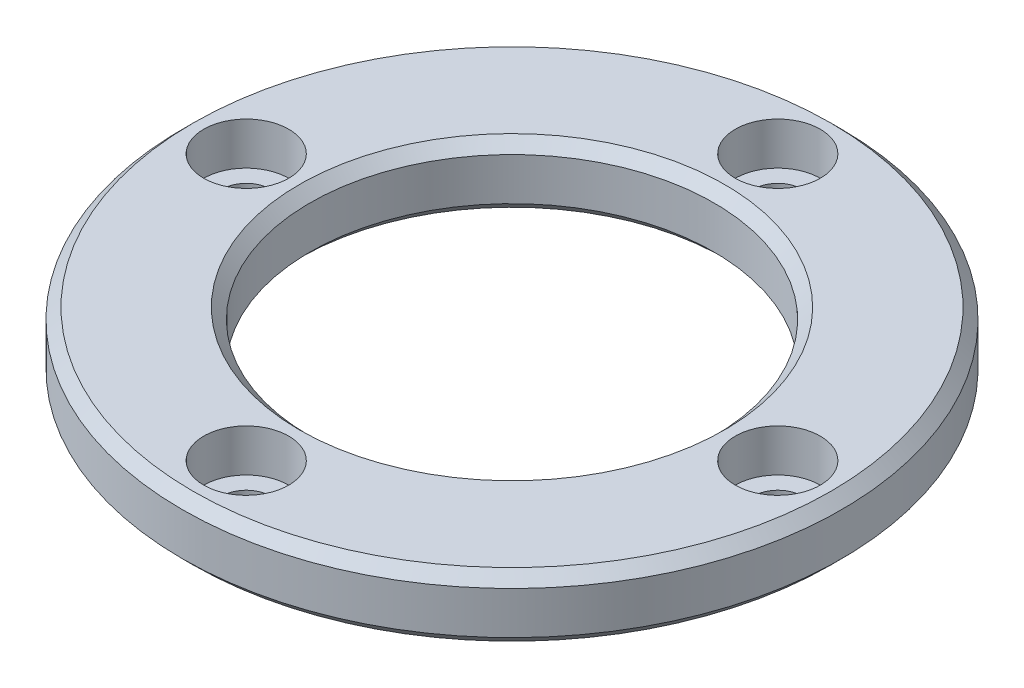
from build123d import *

# Parameters (mm, degrees)
SKETCH1_R                      = 31
SKETCH1_R_2                    = 19
BOSS_EXTRUDE1_DEPTH            = 3
CBORE_FOR_M4_SHCS1_D           = 4.5
CBORE_FOR_M4_SHCS1_CBORE_D     = 8
CBORE_FOR_M4_SHCS1_CBORE_DEPTH = 4
CHAMFER1_SIZE                  = 1
BOSS_EXTRUDE2_START            = 2
SKETCH4_R                      = 3
SKETCH4_R_2                    = 2.25
BOSS_EXTRUDE2_DEPTH            = 2
CHAMFER2_SIZE                  = 0.2
CIRPATTERN1_COUNT              = 4
CHAMFER2_OF_CIRPATTERN1_SIZE   = 0.2


with BuildPart() as part:
    # Sketch1 → Boss-Extrude1 (new, symmetric)
    with BuildSketch(Plane(origin=(0, 0, 0), x_dir=(1, 0, 0), z_dir=(0, 1, 0))):
        Circle(SKETCH1_R)
        Circle(SKETCH1_R_2, mode=Mode.SUBTRACT)
    extrude(amount=BOSS_EXTRUDE1_DEPTH, both=True)

    # CBORE for M4 SHCS1 (through all)
    with Locations(Plane(origin=(0, 3, 0), x_dir=(1, 0, 0), z_dir=(0, 1, 0))):
        with Locations((-25, 0), (0, 25), (25, 0), (0, -25)):
            CounterBoreHole(CBORE_FOR_M4_SHCS1_D / 2, CBORE_FOR_M4_SHCS1_CBORE_D / 2, CBORE_FOR_M4_SHCS1_CBORE_DEPTH)

    # Chamfer1
    chamfer1_edges = [part.edges().sort_by_distance(p)[0] for p in [
        (-31, -3, 0),
        (-31, 3, 0),
        (-19, -3, 0),
        (-19, 3, 0),
    ]]
    chamfer(chamfer1_edges, length=CHAMFER1_SIZE)

    # Sketch4 → Boss-Extrude2 (add)
    with BuildSketch(Plane.XZ.offset(3).offset(BOSS_EXTRUDE2_START)):
        with Locations((-25, 0)):
            Circle(SKETCH4_R)
        with Locations((-25, 0)):
            Circle(SKETCH4_R_2, mode=Mode.SUBTRACT)
    boss_extrude2 = extrude(amount=-BOSS_EXTRUDE2_DEPTH)

    # Chamfer2
    chamfer2_edges = [part.edges().sort_by_distance(p)[0] for p in [
        (-28, -5, 0),
    ]]
    chamfer(chamfer2_edges, length=CHAMFER2_SIZE)

    # CirPattern1: Boss-Extrude2 ×4 about axis
    cirpattern1_axis = Axis((0, 3, 0), (0, -1, 0))
    for i in range(1, CIRPATTERN1_COUNT):
        add(boss_extrude2.rotate(cirpattern1_axis, i * 360 / CIRPATTERN1_COUNT))

    # Chamfer2 of CirPattern1
    chamfer2_of_cirpattern1_edges = [part.edges().sort_by_distance(p)[0] for p in [
        (0, -5, -28),
        (28, -5, 0),
        (0, -5, 28),
    ]]
    chamfer(chamfer2_of_cirpattern1_edges, length=CHAMFER2_OF_CIRPATTERN1_SIZE)


solid = part.part
